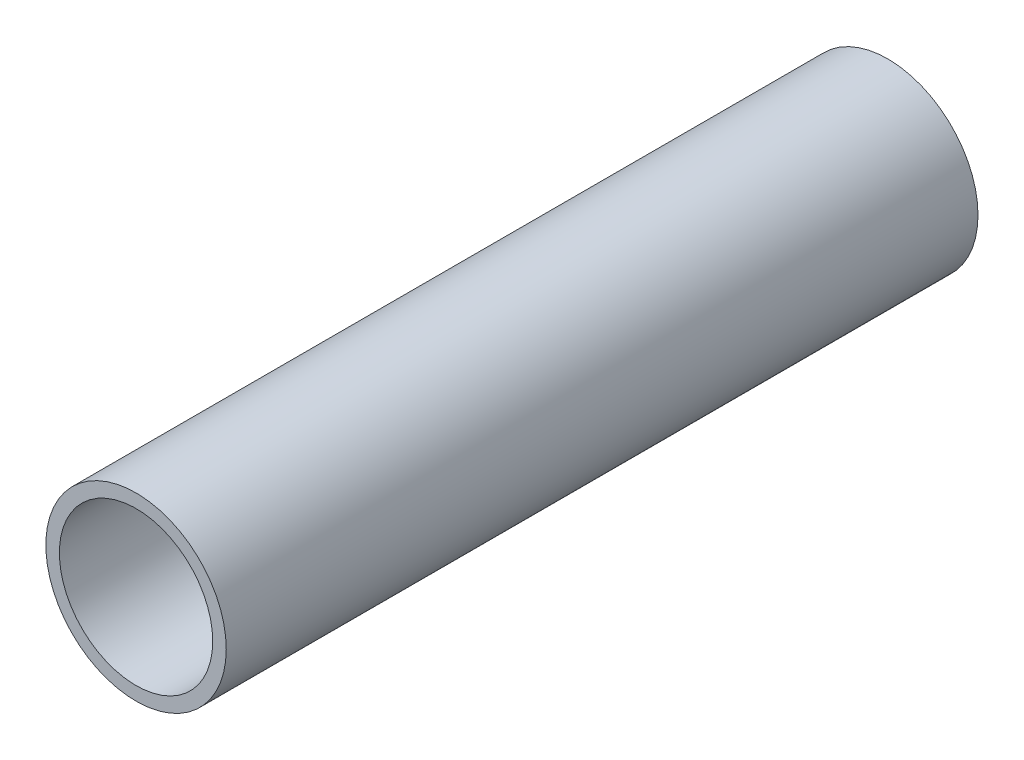
from build123d import *

# Parameters (mm, degrees)
SKETCH_1_R      = 60
SKETCH_1_R_2    = 51
EXTRUDE_1_DEPTH = 500


with BuildPart() as part:
    # Эскиз1 → Бобышка-Вытянуть1 (new body)
    with BuildSketch(Plane.XY):
        Circle(SKETCH_1_R)
        Circle(SKETCH_1_R_2, mode=Mode.SUBTRACT)
    extrude(amount=EXTRUDE_1_DEPTH)


solid = part.part
